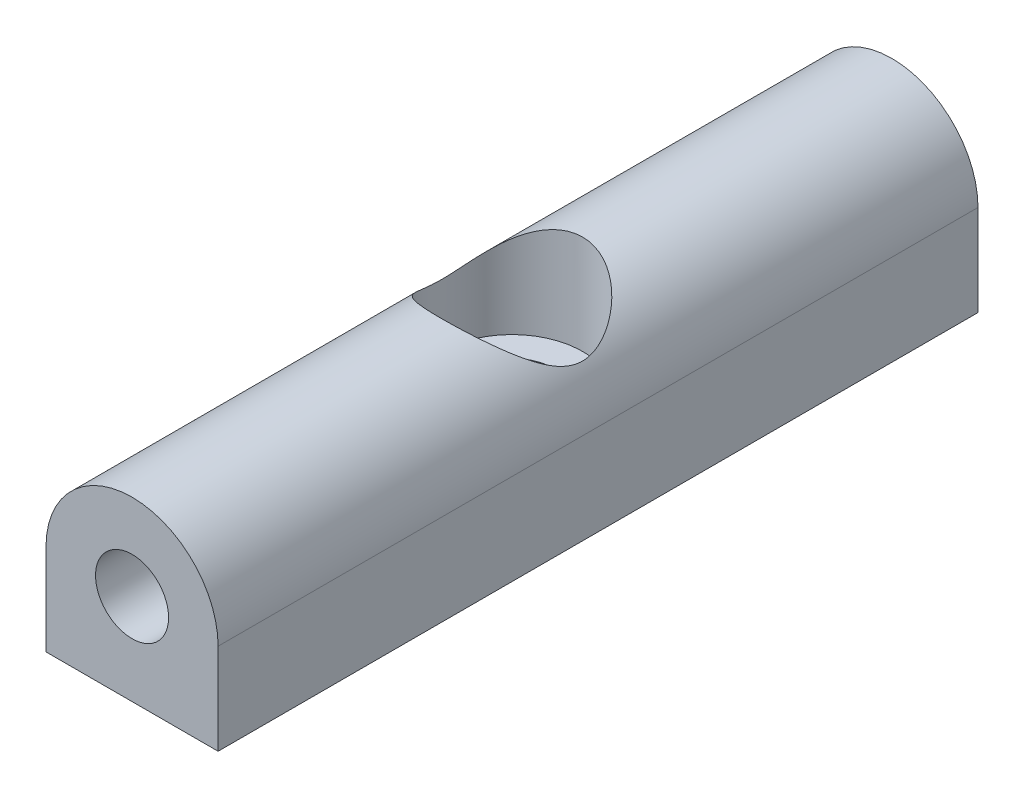
from build123d import *
from build123d.topology import SkipClean

# Parameters (mm, degrees)
SKETCH2_R           = 3.475
BOSS_EXTRUDE2_DEPTH = 30.6846
SKETCH3_R           = 1.475
CUT_EXTRUDE1_DEPTH  = 10
CUT_EXTRUDE2_START  = -10
SKETCH4_R           = 1.475
CUT_EXTRUDE2_DEPTH  = 10
BOSS_EXTRUDE3_DEPTH = 30.6846
SKETCH6_W           = 6.95
SKETCH6_H           = 30.6846
BOSS_EXTRUDE4_DEPTH = 0.2
SKETCH8_W           = 3
SKETCH8_H           = 2
CUT_EXTRUDE3_DEPTH  = 32.675744698
SKETCH10_R          = 2.85
CUT_EXTRUDE4_DEPTH  = 3
SKETCH11_R          = 1.675
CUT_EXTRUDE5_DEPTH  = 32.138726849
BOSS_EXTRUDE5_REACH = 33.487
SKETCH12_R          = 4.85
SKETCH12_R_2        = 2.85
BOSS_EXTRUDE7_START = 1
SKETCH13_R          = 2.85
BOSS_EXTRUDE7_DEPTH = 1
CUT_EXTRUDE6_DEPTH  = 32.282148424
CUT_EXTRUDE7_DEPTH  = 32.877730235


with BuildPart() as part:
    # Sketch2 → Boss-Extrude2 (new body)
    with BuildSketch(Plane.XY):
        Circle(SKETCH2_R)
    extrude(amount=BOSS_EXTRUDE2_DEPTH)

    # Sketch3 → Cut-Extrude1 (cut)
    with BuildSketch(Plane.XY.offset(30.6846)):
        Circle(SKETCH3_R)
    extrude(amount=-CUT_EXTRUDE1_DEPTH, mode=Mode.SUBTRACT)

    # Sketch4 → Cut-Extrude2 (cut)
    with BuildSketch(Plane(origin=(0, 0, 0), x_dir=(-1, 0, 0), z_dir=(0, 0, -1)).offset(CUT_EXTRUDE2_START)):
        with Locations(Location((0, 0, 0), (0, 0, 180))):
            Circle(SKETCH4_R)
    extrude(amount=CUT_EXTRUDE2_DEPTH, mode=Mode.SUBTRACT)

    # Sketch5 → Boss-Extrude3 (add)
    with BuildSketch(Plane(origin=(0, 0, 0), x_dir=(-1, 0, 0), z_dir=(0, 0, -1))):
        with BuildLine():
            ThreePointArc((0, -3.475), (-2.457196065, -2.457196065), (-3.475, 0))
            Line((-3.475, 0), (-3.475, -3.475))
            Line((-3.475, -3.475), (0, -3.475))
        make_face()
        with BuildLine():
            Line((3.475, -3.475), (3.475, 0))
            ThreePointArc((3.475, 0), (2.457196065, -2.457196065), (0, -3.475))
            Line((0, -3.475), (3.475, -3.475))
        make_face()
    extrude(amount=-BOSS_EXTRUDE3_DEPTH)

    # Sketch6 → Boss-Extrude4 (add)
    with BuildSketch(Plane.XZ.offset(3.475)):
        with Locations((0, 15.3423)):
            Rectangle(SKETCH6_W, SKETCH6_H)
    extrude(amount=BOSS_EXTRUDE4_DEPTH)

    # Sketch8 → Cut-Extrude3 (cut, through all)
    with BuildSketch(Plane.ZY.offset(3.475)):
        with Locations((16.8423, 3.475)):
            Rectangle(SKETCH8_W, SKETCH8_H)
        with Locations((13.8423, 3.475)):
            Rectangle(SKETCH8_W, SKETCH8_H)
    extrude(amount=-CUT_EXTRUDE3_DEPTH, mode=Mode.SUBTRACT)

    # Sketch10 → Cut-Extrude4 (cut)
    with BuildSketch(Plane(origin=(0, 2.475, 0), x_dir=(1, 0, 0), z_dir=(0, 1, 0))):
        with Locations(Location((0, -15.3423, 0), (0, 0, 270))):
            Circle(SKETCH10_R)
    extrude(amount=-CUT_EXTRUDE4_DEPTH, mode=Mode.SUBTRACT)

    # Sketch11 → Cut-Extrude5 (cut, through all)
    with BuildSketch(Plane(origin=(0, -0.525, 0), x_dir=(1, 0, 0), z_dir=(0, 1, 0))):
        with Locations(Location((0, -15.3423, 0), (0, 0, 270))):
            Circle(SKETCH11_R)
    extrude(amount=-CUT_EXTRUDE5_DEPTH, mode=Mode.SUBTRACT)

    # Boss-Extrude5: up to this face of the body (flat: up to its plane)
    boss_extrude5_end = Plane(part.part.faces().sort_by_distance((0, -3.675, 30.369981632))[0])
    # Sketch12 → Boss-Extrude5 (add, up to the picked face)
    with BuildSketch(Plane(origin=(0, 2.475, 0), x_dir=(1, 0, 0), z_dir=(0, 1, 0)), mode=Mode.PRIVATE) as boss_extrude5_sk1:
        with Locations((0, -15.3423)):
            Circle(SKETCH12_R)
        with Locations(Location((0, -15.3423, 0), (0, 0, 270))):
            Circle(SKETCH12_R_2, mode=Mode.SUBTRACT)
    boss_extrude5_tool1 = split(extrude(boss_extrude5_sk1.sketch, amount=-BOSS_EXTRUDE5_REACH, mode=Mode.PRIVATE), bisect_by=boss_extrude5_end, keep=Keep.BOTH, mode=Mode.PRIVATE)
    add(boss_extrude5_tool1.solids().sort_by(Axis((-4.712821, 2.475, 15.3423), (0, -1, 0)))[0])

    # Sketch13 → Boss-Extrude7 (add)
    with BuildSketch(Plane(origin=(0, 2.475, 0), x_dir=(1, 0, 0), z_dir=(0, 1, 0)).offset(BOSS_EXTRUDE7_START)):
        with BuildLine():
            Line((-2.439262184, -19.534256584), (-2.439262184, -18.3423))
            Line((-2.439262184, -18.3423), (2.439262184, -18.3423))
            Line((2.439262184, -18.3423), (2.439262184, -19.534256584))
            ThreePointArc((2.439262184, -19.534256584), (4.85, -15.3423), (2.439262184, -11.150343416))
            Line((2.439262184, -11.150343416), (2.439262184, -12.3423))
            Line((2.439262184, -12.3423), (-2.439262184, -12.3423))
            Line((-2.439262184, -12.3423), (-2.439262184, -11.150343416))
            ThreePointArc((-2.439262184, -11.150343416), (-4.85, -15.3423), (-2.439262184, -19.534256584))
        make_face()
        with Locations(Location((0, -15.3423, 0), (0, 0, 270))):
            Circle(SKETCH13_R, mode=Mode.SUBTRACT)
    extrude(amount=-BOSS_EXTRUDE7_DEPTH)

    # Sketch15 → Cut-Extrude6 (cut, through all)
    with SkipClean():  # the faces are left unmerged after this step: merging them gives an invalid solid
        with BuildSketch(Plane(origin=(0, 0, 0), x_dir=(-1, 0, 0), z_dir=(0, 0, -1))):
            with BuildLine():
                Line((6.975728947, 0), (3.475, 0))
                ThreePointArc((3.475, 0), (0, 3.475), (-3.475, 0))
                Line((-3.475, 0), (-8.171324348, 0))
                Line((-8.171324348, 0), (-8.171324348, 6.073396115))
                Line((-8.171324348, 6.073396115), (6.975728947, 6.073396115))
                Line((6.975728947, 6.073396115), (6.975728947, 0))
            make_face()
        extrude(amount=-CUT_EXTRUDE6_DEPTH, mode=Mode.SUBTRACT)
    add(part.part.scale(1), mode=Mode.REPLACE)  # the faces are merged on a copy

    # Sketch16 → Cut-Extrude7 (cut, through all)
    with BuildSketch(Plane(origin=(0, -3.675, 0), x_dir=(-1, 0, 0), z_dir=(0, -1, 0))):
        Polygon((-3.475, -18.725623071), (-3.475, -11.958976929), (-9.441171238, -13.498522389), (-7.451050634, -19.072360919), align=None)
        Polygon((3.475, -18.725623071), (3.475, -11.958976929), (8.590567713, -11.958976929), (7.591441213, -18.725623071), align=None)
    extrude(amount=-CUT_EXTRUDE7_DEPTH, mode=Mode.SUBTRACT)


solid = part.part
